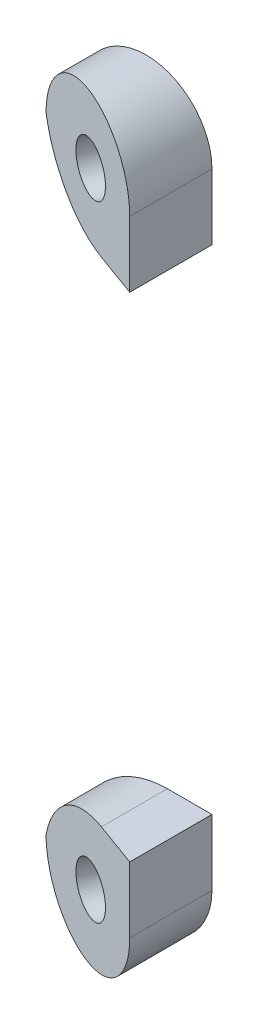
from build123d import *

# Parameters (mm, degrees)
BOSS_EXTRUDE1_DEPTH     = 5
CUT_EXTRUDE1_DEPTH      = 77.124744118
CUT_EXTRUDE1_DEPTH_BACK = 77.124744118
SKETCH3_R               = 1.5
CUT_EXTRUDE2_DEPTH      = 91
SPLIT1_SURFACE_1_BACK   = 47.957
SPLIT1_SURFACE_1_DEPTH  = 95.914
FILLET1_R               = 5.5
FILLET2_R               = 5.5


with BuildPart() as part:
    # Sketch1 → Boss-Extrude1 (new body)
    with BuildSketch(Plane.XY):
        with BuildLine():
            Line((72.394590039, 19), (72.394590039, -19))
            ThreePointArc((72.394590039, -19), (68.394590039, -23), (64.394590039, -19))
            Line((64.394590039, -19), (64.394590039, 19))
            ThreePointArc((64.394590039, 19), (68.394590039, 23), (72.394590039, 19))
        make_face()
    extrude(amount=BOSS_EXTRUDE1_DEPTH)

    # Sketch2 → Cut-Extrude1 (cut, two sides: drawn at the far end of the back side and taken through both)
    with BuildSketch(Plane(origin=(0, 0, 0), x_dir=(1, 0, 0), z_dir=(0, 1, 0)).offset(-CUT_EXTRUDE1_DEPTH_BACK)):
        Polygon((72.394590039, -5), (64.394590039, -2.088238126), (64.394590039, -5), align=None)
    extrude(amount=CUT_EXTRUDE1_DEPTH + CUT_EXTRUDE1_DEPTH_BACK, mode=Mode.SUBTRACT)

    # Sketch3 → Cut-Extrude2 (cut)
    with BuildSketch(Plane(origin=(6.86158929, 0, -18.852061635), x_dir=(0.939692620785907, 0, 0.3420201433256727), z_dir=(-0.3420201433256727, 0, 0.939692620785907))):
        with Locations((65.769891562, 19)):
            Circle(SKETCH3_R)
        with Locations((65.769891562, -19)):
            Circle(SKETCH3_R)
    extrude(amount=-CUT_EXTRUDE2_DEPTH, mode=Mode.SUBTRACT)

    # Split1: cut with a surface, the side it looks to stays
    # Split1 surface: a surface, the sketch's curves swept straight by 95.914 mm
    with BuildLine(Plane.XY.offset(-SPLIT1_SURFACE_1_BACK), mode=Mode.PRIVATE) as split1_surface_1_path:
        Line((89.276904546, -15), (55.512275533, -15))
        Line((55.512275533, -15), (55.512275533, 15))
        Line((55.512275533, 15), (89.276904546, 15))
        Line((89.276904546, 15), (89.276904546, -15))
    split1_surface_1 = Shell.extrude(split1_surface_1_path.wire(), (0 * SPLIT1_SURFACE_1_DEPTH, 0 * SPLIT1_SURFACE_1_DEPTH, 1 * SPLIT1_SURFACE_1_DEPTH))
    split(bisect_by=split1_surface_1, keep=Keep.TOP)

    # Fillet1
    # the kernel refuses this fillet: 5.5 mm, written as the material it takes off along each edge
    with BuildSketch(Plane(origin=(64.394590039, 15, 15.316994681), x_dir=(1, 0, 0), z_dir=(0, 0, -1))) as fillet1_piece_1:
        with BuildLine():
            CenterArc((5.291502622, -5.5), FILLET1_R, 90, 74.173379868)
            Line((0, -4), (0, 0))
            Line((0, 0), (5.291502622, 0))
        make_face()
    extrude(amount=28.545751237, mode=Mode.SUBTRACT)

    # Fillet2
    # the kernel refuses this fillet: 5.5 mm, written as the material it takes off along each edge
    with BuildSketch(Plane(origin=(64.394590039, -15, -13.228756555), x_dir=(1, 0, 0), z_dir=(0, 0, 1))) as fillet2_piece_1:
        with BuildLine():
            CenterArc((5.291502622, -5.5), FILLET2_R, 90, 74.173379868)
            Line((0, -4), (0, 0))
            Line((0, 0), (5.291502622, 0))
        make_face()
    extrude(amount=28.545751237, mode=Mode.SUBTRACT)


solid = part.part
